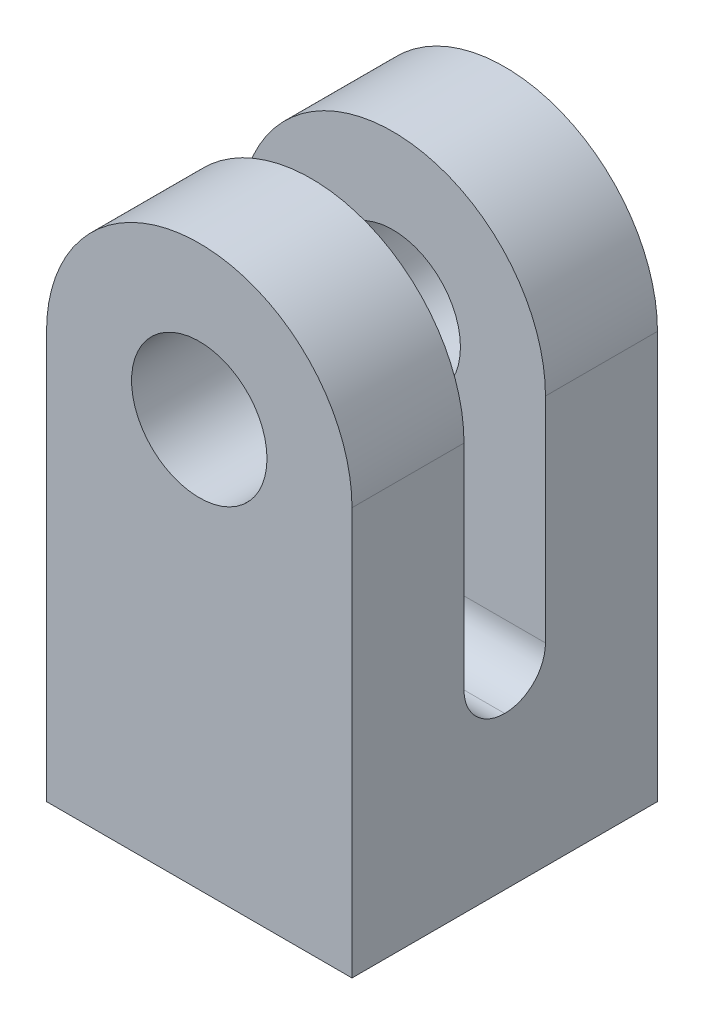
from build123d import *

# Parameters (mm, degrees)
SKETCH1_R           = 6.65
BOSS_EXTRUDE1_DEPTH = 30
SKETCH2_W           = 8
SKETCH2_H           = 40
CUT_EXTRUDE1_DEPTH  = 70.462219947
FILLET1_R           = 4


with BuildPart() as part:
    # Sketch1 → Boss-Extrude1 (new body)
    with BuildSketch(Plane.XY):
        with BuildLine():
            Line((0, 0), (30, 0))
            Line((30, 0), (30, 40))
            ThreePointArc((30, 40), (15, 55), (0, 40))
            Line((0, 40), (0, 0))
        make_face()
        with Locations((15, 40)):
            Circle(SKETCH1_R, mode=Mode.SUBTRACT)
    extrude(amount=BOSS_EXTRUDE1_DEPTH)

    # Sketch2 → Cut-Extrude1 (cut, through all)
    with BuildSketch(Plane.ZY):
        with Locations((15, 35)):
            Rectangle(SKETCH2_W, SKETCH2_H)
    extrude(amount=-CUT_EXTRUDE1_DEPTH, mode=Mode.SUBTRACT)

    # Fillet1
    fillet1_edges = [part.edges().sort_by_distance(p)[0] for p in [
        (15, 15, 19),
        (15, 15, 11),
    ]]
    fillet(fillet1_edges, radius=FILLET1_R - 0.0001)  # a hair under: the kernel refuses the full size


solid = part.part
